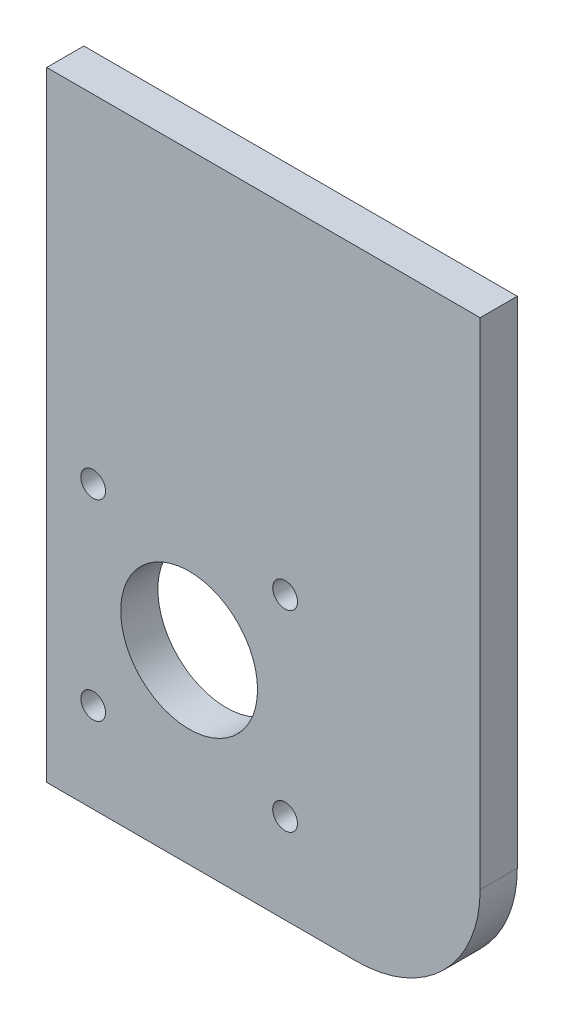
from build123d import *

# Parameters (mm, degrees)
EXTRUDE_1_DEPTH     = 6
SKETCH_2_R          = 11.05
SKETCH_2_R_2        = 2
CUT_EXTRUDE_1_DEPTH = 402.156818338


with BuildPart() as part:
    # Эскиз1 → Бобышка-Вытянуть1 (new body)
    with BuildSketch(Plane.XY):
        with BuildLine():
            Line((6, -293.846153846), (6, -393.846153846))
            Line((6, -393.846153846), (56, -393.846153846))
            ThreePointArc((56, -393.846153846), (70.142135624, -387.98828947), (76, -373.846153846))
            Line((76, -373.846153846), (76, -293.846153846))
            Line((76, -293.846153846), (6, -293.846153846))
        make_face()
    extrude(amount=-EXTRUDE_1_DEPTH)

    # Эскиз2 → Вырез-Вытянуть1 (cut, through all)
    with BuildSketch(Plane.XY):
        with Locations((29, -363.846153846)):
            Circle(SKETCH_2_R)
        with Locations((44.5, -379.346153846)):
            Circle(SKETCH_2_R_2)
        with Locations((13.5, -379.346153846)):
            Circle(SKETCH_2_R_2)
        with Locations((13.5, -348.346153846)):
            Circle(SKETCH_2_R_2)
        with Locations((44.5, -348.346153846)):
            Circle(SKETCH_2_R_2)
    extrude(amount=-CUT_EXTRUDE_1_DEPTH, mode=Mode.SUBTRACT)


solid = part.part
